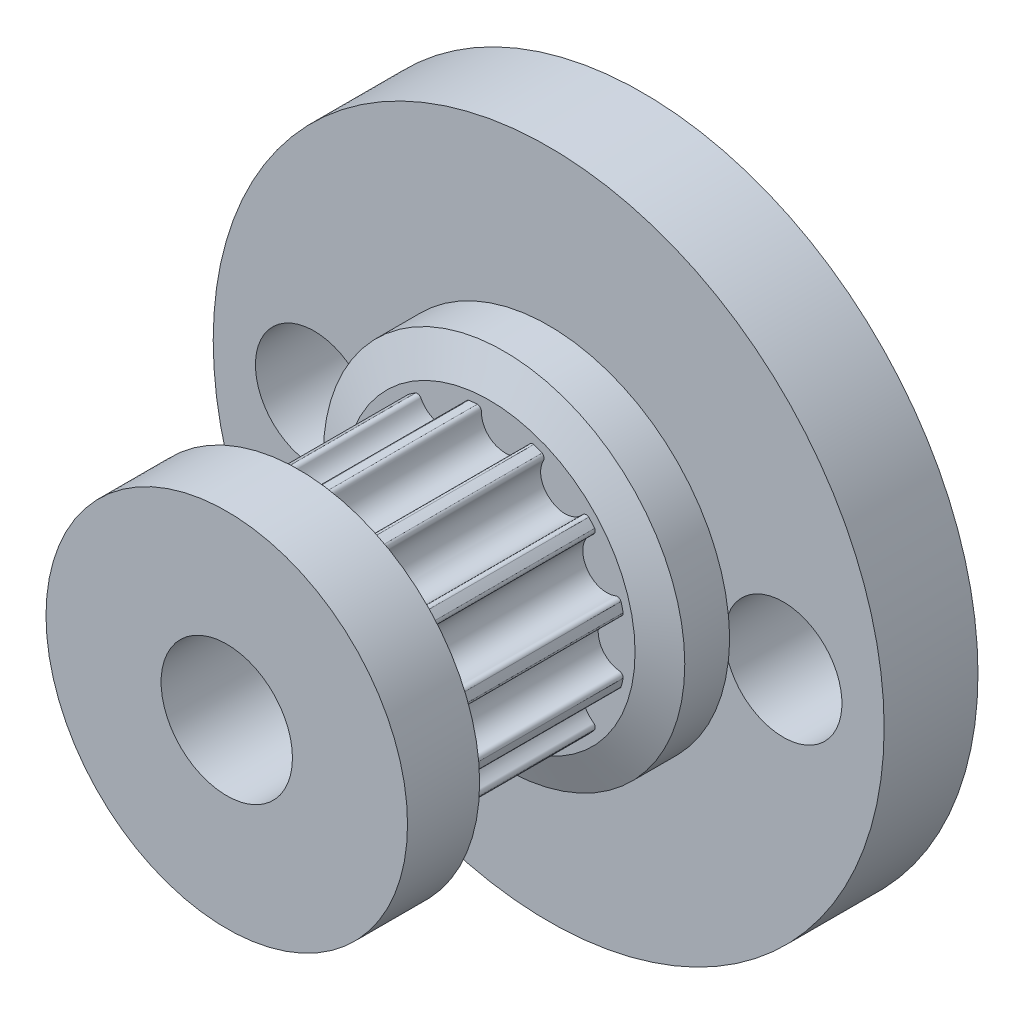
from build123d import *

# Parameters (mm, degrees)
TOOTHEXTRUDECUTGEARBELT01_DEPTH = 3.75179993
PATTERNGEARBELT01_COUNT         = 13
BOSS_EXTRUDE2_START             = -0.90326
SKETCH5_R                       = 7.705197088
BOSS_EXTRUDE2_DEPTH             = 1.90326
SKETCH6_R                       = 7.705197088
BOSS_EXTRUDE4_DEPTH             = 1.17
CUT_EXTRUDE2_START              = -12.7216
CUT_EXTRUDE2_DEPTH              = 30.472099271
BOSS_EXTRUDE3_START             = 1
SKETCH5_3_R                     = 14.3
SKETCH5_3_R_2                   = 2.5
SKETCH5_3_R_3                   = 2.8
BOSS_EXTRUDE3_DEPTH             = 4


with BuildPart() as part:
    # SketchRevolveGearBelt01 → GearBelt01 (revolve)
    with BuildSketch(Plane(origin=(0, 0, 0), x_dir=(0, 0, -1), z_dir=(1, 0, 0)), mode=Mode.PRIVATE) as gearbelt01_sk:
        Polygon((5.2757999, 0), (5.2757999, 5.190597126), (4.51379992, 5.190597126), (4.51379992, 6.055025889), (5.07653656, 7.413592317), (4.372540367, 7.705197088), (3.75179993, 6.206597107), (3.75179993, 5.825597113), (-3.75179993, 5.825597113), (-3.75179993, 6.206597107), (-4.372540367, 7.705197088), (-5.07653656, 7.413592317), (-4.51379992, 6.055025889), (-4.51379992, 5.190597126), (-5.2757999, 5.190597126), (-5.2757999, 0), align=None)
    revolve(gearbelt01_sk.sketch.rotate(Axis((0, 0, 0), (0, 0, -1)), 90), axis=Axis((0, 0, 0), (0, 0, -1)))

    # SketchToothGearBelt01 → ToothExtrudeCutGearBelt01 (cut, symmetric)
    with BuildSketch(Plane.XY):
        with BuildLine():
            ThreePointArc((5.694892079, 1.238985826), (5.82811133, 0), (5.694892079, -1.238985826))
            add(Edge.make_bspline(
                [(5.694892079, -1.238985826), (5.697177057, -1.228489495), (5.699194946, -1.212438974), (5.699015589, -1.190934318), (5.697447837, -1.174881659), (5.694459096, -1.159031946), (5.690073082, -1.143510711), (5.684324518, -1.128440876), (5.677258937, -1.113941791), (5.668932293, -1.100128287), (5.659410534, -1.087109759), (5.648769066, -1.07498933), (5.637092178, -1.063862917), (5.624472313, -1.053818916), (5.611009544, -1.044935833), (5.596810022, -1.03728791), (5.58198796, -1.030921195), (5.566654196, -1.025940308), (5.55095461, -1.022182426), (5.517566972, -1.018537534), (5.464967856, -1.005661424), (5.391433133, -0.99322849), (5.316880193, -0.971191628), (5.244078819, -0.944232687), (5.173663428, -0.911435203), (5.106015211, -0.873290054), (5.04156233, -0.829953387), (4.980696233, -0.781711646), (4.923790969, -0.728854955), (4.87119508, -0.671708794), (4.823231033, -0.610623043), (4.780192773, -0.545972238), (4.74234423, -0.478152621), (4.709916952, -0.407579931), (4.683111362, -0.334686642), (4.662085571, -0.259919934), (4.646991584, -0.183736684), (4.637835603, -0.106609111), (4.635765562, -0.050027961), (4.635859666, -0.014500084), (4.635846864, 0), (4.635859666, 0.014500084), (4.635765562, 0.050027961), (4.637835603, 0.106609111), (4.646991584, 0.183736684), (4.662085571, 0.259919934), (4.683111362, 0.334686642), (4.709916952, 0.407579931), (4.74234423, 0.478152621), (4.780192773, 0.545972238), (4.823231033, 0.610623043), (4.87119508, 0.671708794), (4.923790969, 0.728854955), (4.980696233, 0.781711646), (5.04156233, 0.829953387), (5.106015211, 0.873290054), (5.173663428, 0.911435203), (5.244078819, 0.944232687), (5.316880193, 0.971191628), (5.391433133, 0.99322849), (5.464967856, 1.005661424), (5.517566972, 1.018537534), (5.55095461, 1.022182426), (5.566654196, 1.025940308), (5.58198796, 1.030921195), (5.596810022, 1.03728791), (5.611009544, 1.044935833), (5.624472313, 1.053818916), (5.637092178, 1.063862917), (5.648769066, 1.07498933), (5.659410534, 1.087109759), (5.668932293, 1.100128287), (5.677258937, 1.113941791), (5.684324518, 1.128440876), (5.690073082, 1.143510711), (5.694459096, 1.159031946), (5.697447837, 1.174881659), (5.699015589, 1.190934318), (5.699194946, 1.212438974), (5.697177057, 1.228489495), (5.694892079, 1.238985826)],
                knots=[0, 0, 0, 0, 0.008948615, 0.013422922, 0.01789723, 0.022371537, 0.026845844, 0.031320152, 0.035794459, 0.040268767, 0.044743074, 0.049217381, 0.053691689, 0.058165996, 0.062640304, 0.067114611, 0.071588919, 0.076063226, 0.080537533, 0.085011841, 0.104016804, 0.125568346, 0.147119888, 0.168671431, 0.190222973, 0.211774515, 0.233326058, 0.2548776, 0.276429142, 0.297980685, 0.319532227, 0.341083769, 0.362635312, 0.384186854, 0.405738396, 0.427289939, 0.448841481, 0.470393024, 0.491944566, 0.495972283, 0.5, 0.504027717, 0.508055434, 0.529606976, 0.551158519, 0.572710061, 0.594261604, 0.615813146, 0.637364688, 0.658916231, 0.680467773, 0.702019315, 0.723570858, 0.7451224, 0.766673942, 0.788225485, 0.809777027, 0.831328569, 0.852880112, 0.874431654, 0.895983196, 0.914988159, 0.919462467, 0.923936774, 0.928411081, 0.932885389, 0.937359696, 0.941834004, 0.946308311, 0.950782619, 0.955256926, 0.959731233, 0.964205541, 0.968679848, 0.973154156, 0.977628463, 0.98210277, 0.986577078, 0.991051385, 1, 1, 1, 1], degree=3))
        make_face()
    toothextrudecutgearbelt01 = extrude(amount=TOOTHEXTRUDECUTGEARBELT01_DEPTH, both=True, mode=Mode.SUBTRACT)

    # PatternGearBelt01: ToothExtrudeCutGearBelt01 ×13 about axis
    patterngearbelt01_axis = Axis((0, 0, 55), (0, 0, -1))
    for i in range(1, PATTERNGEARBELT01_COUNT):
        add(toothextrudecutgearbelt01.rotate(patterngearbelt01_axis, i * 360 / PATTERNGEARBELT01_COUNT), mode=Mode.SUBTRACT)

    # Sketch5 → Boss-Extrude2 (add)
    with BuildSketch(Plane(origin=(0, 0, -5.2757999), x_dir=(-1, 0, 0), z_dir=(0, 0, -1)).offset(BOSS_EXTRUDE2_START)):
        with Locations(Location((0, 0, 0), (0, 0, 180))):
            Circle(SKETCH5_R)
    boss_extrude2 = extrude(amount=BOSS_EXTRUDE2_DEPTH)

    # Mirror1: Boss-Extrude2 across plane
    add(boss_extrude2.mirror(Plane.XY))

    # Sketch6 → Boss-Extrude4 (add)
    with BuildSketch(Plane.XY.offset(6.2757999)):
        Circle(SKETCH6_R)
    extrude(amount=BOSS_EXTRUDE4_DEPTH)

    # Sketch5<4> → Cut-Extrude2 (cut, through all)
    with BuildSketch(Plane(origin=(0, 0, -5.2757999), x_dir=(-1, 0, 0), z_dir=(0, 0, -1)).offset(CUT_EXTRUDE2_START)):
        with BuildLine():
            ThreePointArc((2.8, 0), (0, 2.8), (-2.8, 0))
            Line((-2.8, 0), (2.8, 0))
        make_face()
        with BuildLine():
            Line((2.8, 0), (-2.8, 0))
            ThreePointArc((-2.8, 0), (0, -2.8), (2.8, 0))
        make_face()
    extrude(amount=CUT_EXTRUDE2_DEPTH, mode=Mode.SUBTRACT)

    # Sketch5<3> → Boss-Extrude3 (add)
    with BuildSketch(Plane(origin=(0, 0, -5.2757999), x_dir=(-1, 0, 0), z_dir=(0, 0, -1)).offset(BOSS_EXTRUDE3_START)):
        Circle(SKETCH5_3_R)
        with Locations(Location((-10, 0, 0), (0, 0, 20.347868317))):
            Circle(SKETCH5_3_R_2, mode=Mode.SUBTRACT)
        with Locations(Location((10, 0, 0), (0, 0, 200.347868317))):
            Circle(SKETCH5_3_R_2, mode=Mode.SUBTRACT)
        with Locations(Location((0, 0, 0), (0, 0, 180))):
            Circle(SKETCH5_3_R_3, mode=Mode.SUBTRACT)
    extrude(amount=BOSS_EXTRUDE3_DEPTH)


solid = part.part
